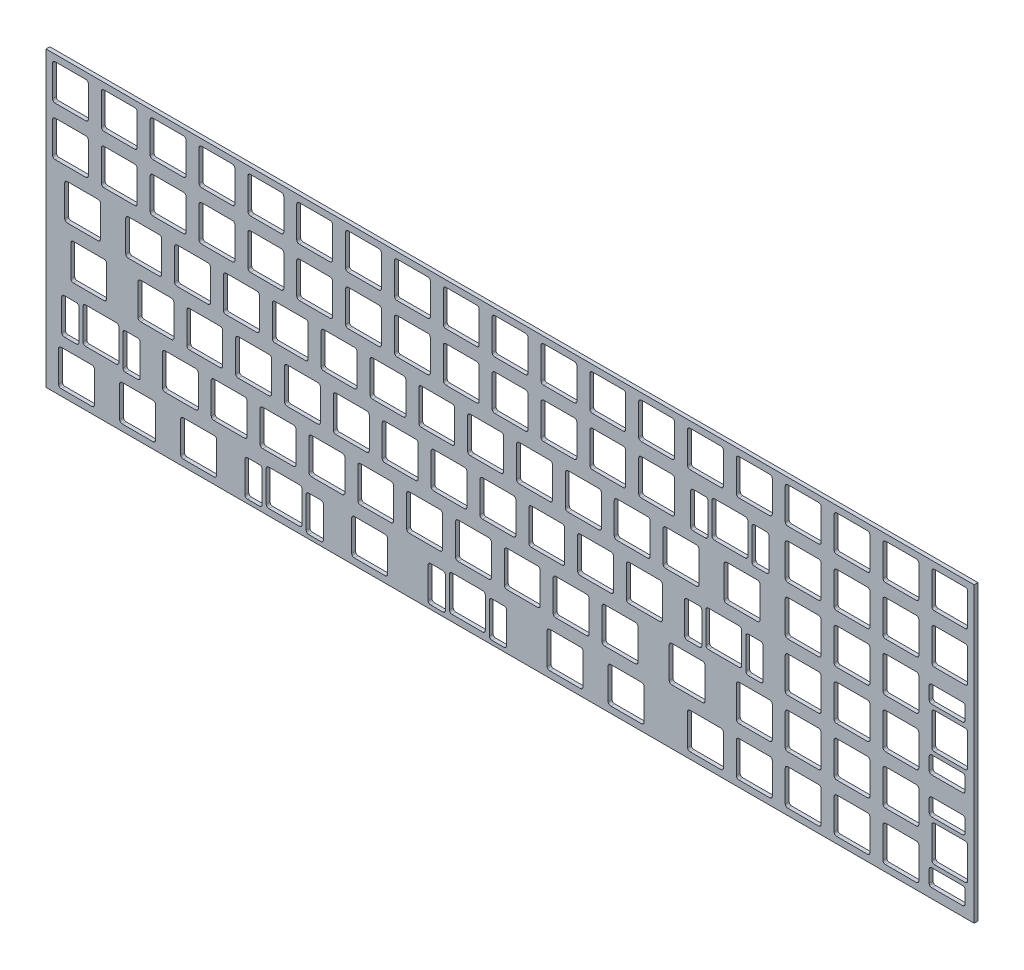
from build123d import *

# Parameters (mm, degrees)
MODEL_W             = 361.952
MODEL_H             = 114.3
BOSS_EXTRUDE1_DEPTH = 1.5


with BuildPart() as part:
    # Model → Boss-Extrude1 (new body)
    with BuildSketch(Plane.XY):
        with Locations((180.976, -57.15)):
            Rectangle(MODEL_W, MODEL_H)
        with BuildLine():
            Line((3.525, -2.525), (15.525, -2.525))
            ThreePointArc((15.525, -2.525), (16.232106781, -2.817893219), (16.525, -3.525))
            Line((16.525, -3.525), (16.525, -15.525))
            ThreePointArc((16.525, -15.525), (16.232106781, -16.232106781), (15.525, -16.525))
            Line((15.525, -16.525), (3.525, -16.525))
            ThreePointArc((3.525, -16.525), (2.817893219, -16.232106781), (2.525, -15.525))
            Line((2.525, -15.525), (2.525, -3.525))
            ThreePointArc((2.525, -3.525), (2.817893219, -2.817893219), (3.525, -2.525))
        make_face(mode=Mode.SUBTRACT)
        with BuildLine():
            Line((22.575, -2.525), (34.575, -2.525))
            ThreePointArc((34.575, -2.525), (35.282106781, -2.817893219), (35.575, -3.525))
            Line((35.575, -3.525), (35.575, -15.525))
            ThreePointArc((35.575, -15.525), (35.282106781, -16.232106781), (34.575, -16.525))
            Line((34.575, -16.525), (22.575, -16.525))
            ThreePointArc((22.575, -16.525), (21.867893219, -16.232106781), (21.575, -15.525))
            Line((21.575, -15.525), (21.575, -3.525))
            ThreePointArc((21.575, -3.525), (21.867893219, -2.817893219), (22.575, -2.525))
        make_face(mode=Mode.SUBTRACT)
        with BuildLine():
            Line((41.625, -2.525), (53.625, -2.525))
            ThreePointArc((53.625, -2.525), (54.332106781, -2.817893219), (54.625, -3.525))
            Line((54.625, -3.525), (54.625, -15.525))
            ThreePointArc((54.625, -15.525), (54.332106781, -16.232106781), (53.625, -16.525))
            Line((53.625, -16.525), (41.625, -16.525))
            ThreePointArc((41.625, -16.525), (40.917893219, -16.232106781), (40.625, -15.525))
            Line((40.625, -15.525), (40.625, -3.525))
            ThreePointArc((40.625, -3.525), (40.917893219, -2.817893219), (41.625, -2.525))
        make_face(mode=Mode.SUBTRACT)
        with BuildLine():
            Line((60.675, -2.525), (72.675, -2.525))
            ThreePointArc((72.675, -2.525), (73.382106781, -2.817893219), (73.675, -3.525))
            Line((73.675, -3.525), (73.675, -15.525))
            ThreePointArc((73.675, -15.525), (73.382106781, -16.232106781), (72.675, -16.525))
            Line((72.675, -16.525), (60.675, -16.525))
            ThreePointArc((60.675, -16.525), (59.967893219, -16.232106781), (59.675, -15.525))
            Line((59.675, -15.525), (59.675, -3.525))
            ThreePointArc((59.675, -3.525), (59.967893219, -2.817893219), (60.675, -2.525))
        make_face(mode=Mode.SUBTRACT)
        with BuildLine():
            Line((79.725, -2.525), (91.725, -2.525))
            ThreePointArc((91.725, -2.525), (92.432106781, -2.817893219), (92.725, -3.525))
            Line((92.725, -3.525), (92.725, -15.525))
            ThreePointArc((92.725, -15.525), (92.432106781, -16.232106781), (91.725, -16.525))
            Line((91.725, -16.525), (79.725, -16.525))
            ThreePointArc((79.725, -16.525), (79.017893219, -16.232106781), (78.725, -15.525))
            Line((78.725, -15.525), (78.725, -3.525))
            ThreePointArc((78.725, -3.525), (79.017893219, -2.817893219), (79.725, -2.525))
        make_face(mode=Mode.SUBTRACT)
        with BuildLine():
            Line((98.775, -2.525), (110.775, -2.525))
            ThreePointArc((110.775, -2.525), (111.482106781, -2.817893219), (111.775, -3.525))
            Line((111.775, -3.525), (111.775, -15.525))
            ThreePointArc((111.775, -15.525), (111.482106781, -16.232106781), (110.775, -16.525))
            Line((110.775, -16.525), (98.775, -16.525))
            ThreePointArc((98.775, -16.525), (98.067893219, -16.232106781), (97.775, -15.525))
            Line((97.775, -15.525), (97.775, -3.525))
            ThreePointArc((97.775, -3.525), (98.067893219, -2.817893219), (98.775, -2.525))
        make_face(mode=Mode.SUBTRACT)
        with BuildLine():
            Line((117.825, -2.525), (129.825, -2.525))
            ThreePointArc((129.825, -2.525), (130.532106781, -2.817893219), (130.825, -3.525))
            Line((130.825, -3.525), (130.825, -15.525))
            ThreePointArc((130.825, -15.525), (130.532106781, -16.232106781), (129.825, -16.525))
            Line((129.825, -16.525), (117.825, -16.525))
            ThreePointArc((117.825, -16.525), (117.117893219, -16.232106781), (116.825, -15.525))
            Line((116.825, -15.525), (116.825, -3.525))
            ThreePointArc((116.825, -3.525), (117.117893219, -2.817893219), (117.825, -2.525))
        make_face(mode=Mode.SUBTRACT)
        with BuildLine():
            Line((136.875, -2.525), (148.875, -2.525))
            ThreePointArc((148.875, -2.525), (149.582106781, -2.817893219), (149.875, -3.525))
            Line((149.875, -3.525), (149.875, -15.525))
            ThreePointArc((149.875, -15.525), (149.582106781, -16.232106781), (148.875, -16.525))
            Line((148.875, -16.525), (136.875, -16.525))
            ThreePointArc((136.875, -16.525), (136.167893219, -16.232106781), (135.875, -15.525))
            Line((135.875, -15.525), (135.875, -3.525))
            ThreePointArc((135.875, -3.525), (136.167893219, -2.817893219), (136.875, -2.525))
        make_face(mode=Mode.SUBTRACT)
        with BuildLine():
            Line((155.925, -2.525), (167.925, -2.525))
            ThreePointArc((167.925, -2.525), (168.632106781, -2.817893219), (168.925, -3.525))
            Line((168.925, -3.525), (168.925, -15.525))
            ThreePointArc((168.925, -15.525), (168.632106781, -16.232106781), (167.925, -16.525))
            Line((167.925, -16.525), (155.925, -16.525))
            ThreePointArc((155.925, -16.525), (155.217893219, -16.232106781), (154.925, -15.525))
            Line((154.925, -15.525), (154.925, -3.525))
            ThreePointArc((154.925, -3.525), (155.217893219, -2.817893219), (155.925, -2.525))
        make_face(mode=Mode.SUBTRACT)
        with BuildLine():
            Line((174.975, -2.525), (186.975, -2.525))
            ThreePointArc((186.975, -2.525), (187.682106781, -2.817893219), (187.975, -3.525))
            Line((187.975, -3.525), (187.975, -15.525))
            ThreePointArc((187.975, -15.525), (187.682106781, -16.232106781), (186.975, -16.525))
            Line((186.975, -16.525), (174.975, -16.525))
            ThreePointArc((174.975, -16.525), (174.267893219, -16.232106781), (173.975, -15.525))
            Line((173.975, -15.525), (173.975, -3.525))
            ThreePointArc((173.975, -3.525), (174.267893219, -2.817893219), (174.975, -2.525))
        make_face(mode=Mode.SUBTRACT)
        with BuildLine():
            Line((194.025, -2.525), (206.025, -2.525))
            ThreePointArc((206.025, -2.525), (206.732106781, -2.817893219), (207.025, -3.525))
            Line((207.025, -3.525), (207.025, -15.525))
            ThreePointArc((207.025, -15.525), (206.732106781, -16.232106781), (206.025, -16.525))
            Line((206.025, -16.525), (194.025, -16.525))
            ThreePointArc((194.025, -16.525), (193.317893219, -16.232106781), (193.025, -15.525))
            Line((193.025, -15.525), (193.025, -3.525))
            ThreePointArc((193.025, -3.525), (193.317893219, -2.817893219), (194.025, -2.525))
        make_face(mode=Mode.SUBTRACT)
        with BuildLine():
            Line((213.075, -2.525), (225.075, -2.525))
            ThreePointArc((225.075, -2.525), (225.782106781, -2.817893219), (226.075, -3.525))
            Line((226.075, -3.525), (226.075, -15.525))
            ThreePointArc((226.075, -15.525), (225.782106781, -16.232106781), (225.075, -16.525))
            Line((225.075, -16.525), (213.075, -16.525))
            ThreePointArc((213.075, -16.525), (212.367893219, -16.232106781), (212.075, -15.525))
            Line((212.075, -15.525), (212.075, -3.525))
            ThreePointArc((212.075, -3.525), (212.367893219, -2.817893219), (213.075, -2.525))
        make_face(mode=Mode.SUBTRACT)
        with BuildLine():
            Line((232.125, -2.525), (244.125, -2.525))
            ThreePointArc((244.125, -2.525), (244.832106781, -2.817893219), (245.125, -3.525))
            Line((245.125, -3.525), (245.125, -15.525))
            ThreePointArc((245.125, -15.525), (244.832106781, -16.232106781), (244.125, -16.525))
            Line((244.125, -16.525), (232.125, -16.525))
            ThreePointArc((232.125, -16.525), (231.417893219, -16.232106781), (231.125, -15.525))
            Line((231.125, -15.525), (231.125, -3.525))
            ThreePointArc((231.125, -3.525), (231.417893219, -2.817893219), (232.125, -2.525))
        make_face(mode=Mode.SUBTRACT)
        with BuildLine():
            Line((251.175, -2.525), (263.175, -2.525))
            ThreePointArc((263.175, -2.525), (263.882106781, -2.817893219), (264.175, -3.525))
            Line((264.175, -3.525), (264.175, -15.525))
            ThreePointArc((264.175, -15.525), (263.882106781, -16.232106781), (263.175, -16.525))
            Line((263.175, -16.525), (251.175, -16.525))
            ThreePointArc((251.175, -16.525), (250.467893219, -16.232106781), (250.175, -15.525))
            Line((250.175, -15.525), (250.175, -3.525))
            ThreePointArc((250.175, -3.525), (250.467893219, -2.817893219), (251.175, -2.525))
        make_face(mode=Mode.SUBTRACT)
        with BuildLine():
            Line((270.225, -2.525), (282.225, -2.525))
            ThreePointArc((282.225, -2.525), (282.932106781, -2.817893219), (283.225, -3.525))
            Line((283.225, -3.525), (283.225, -15.525))
            ThreePointArc((283.225, -15.525), (282.932106781, -16.232106781), (282.225, -16.525))
            Line((282.225, -16.525), (270.225, -16.525))
            ThreePointArc((270.225, -16.525), (269.517893219, -16.232106781), (269.225, -15.525))
            Line((269.225, -15.525), (269.225, -3.525))
            ThreePointArc((269.225, -3.525), (269.517893219, -2.817893219), (270.225, -2.525))
        make_face(mode=Mode.SUBTRACT)
        with BuildLine():
            Line((289.275, -2.525), (301.275, -2.525))
            ThreePointArc((301.275, -2.525), (301.982106781, -2.817893219), (302.275, -3.525))
            Line((302.275, -3.525), (302.275, -15.525))
            ThreePointArc((302.275, -15.525), (301.982106781, -16.232106781), (301.275, -16.525))
            Line((301.275, -16.525), (289.275, -16.525))
            ThreePointArc((289.275, -16.525), (288.567893219, -16.232106781), (288.275, -15.525))
            Line((288.275, -15.525), (288.275, -3.525))
            ThreePointArc((288.275, -3.525), (288.567893219, -2.817893219), (289.275, -2.525))
        make_face(mode=Mode.SUBTRACT)
        with BuildLine():
            Line((308.325, -2.525), (320.325, -2.525))
            ThreePointArc((320.325, -2.525), (321.032106781, -2.817893219), (321.325, -3.525))
            Line((321.325, -3.525), (321.325, -15.525))
            ThreePointArc((321.325, -15.525), (321.032106781, -16.232106781), (320.325, -16.525))
            Line((320.325, -16.525), (308.325, -16.525))
            ThreePointArc((308.325, -16.525), (307.617893219, -16.232106781), (307.325, -15.525))
            Line((307.325, -15.525), (307.325, -3.525))
            ThreePointArc((307.325, -3.525), (307.617893219, -2.817893219), (308.325, -2.525))
        make_face(mode=Mode.SUBTRACT)
        with BuildLine():
            Line((327.375, -2.525), (339.375, -2.525))
            ThreePointArc((339.375, -2.525), (340.082106781, -2.817893219), (340.375, -3.525))
            Line((340.375, -3.525), (340.375, -15.525))
            ThreePointArc((340.375, -15.525), (340.082106781, -16.232106781), (339.375, -16.525))
            Line((339.375, -16.525), (327.375, -16.525))
            ThreePointArc((327.375, -16.525), (326.667893219, -16.232106781), (326.375, -15.525))
            Line((326.375, -15.525), (326.375, -3.525))
            ThreePointArc((326.375, -3.525), (326.667893219, -2.817893219), (327.375, -2.525))
        make_face(mode=Mode.SUBTRACT)
        with BuildLine():
            Line((346.425, -2.525), (358.425, -2.525))
            ThreePointArc((358.425, -2.525), (359.132106781, -2.817893219), (359.425, -3.525))
            Line((359.425, -3.525), (359.425, -15.525))
            ThreePointArc((359.425, -15.525), (359.132106781, -16.232106781), (358.425, -16.525))
            Line((358.425, -16.525), (346.425, -16.525))
            ThreePointArc((346.425, -16.525), (345.717893219, -16.232106781), (345.425, -15.525))
            Line((345.425, -15.525), (345.425, -3.525))
            ThreePointArc((345.425, -3.525), (345.717893219, -2.817893219), (346.425, -2.525))
        make_face(mode=Mode.SUBTRACT)
        with BuildLine():
            Line((3.525, -21.575), (15.525, -21.575))
            ThreePointArc((15.525, -21.575), (16.232106781, -21.867893219), (16.525, -22.575))
            Line((16.525, -22.575), (16.525, -34.575))
            ThreePointArc((16.525, -34.575), (16.232106781, -35.282106781), (15.525, -35.575))
            Line((15.525, -35.575), (3.525, -35.575))
            ThreePointArc((3.525, -35.575), (2.817893219, -35.282106781), (2.525, -34.575))
            Line((2.525, -34.575), (2.525, -22.575))
            ThreePointArc((2.525, -22.575), (2.817893219, -21.867893219), (3.525, -21.575))
        make_face(mode=Mode.SUBTRACT)
        with BuildLine():
            Line((22.575, -21.575), (34.575, -21.575))
            ThreePointArc((34.575, -21.575), (35.282106781, -21.867893219), (35.575, -22.575))
            Line((35.575, -22.575), (35.575, -34.575))
            ThreePointArc((35.575, -34.575), (35.282106781, -35.282106781), (34.575, -35.575))
            Line((34.575, -35.575), (22.575, -35.575))
            ThreePointArc((22.575, -35.575), (21.867893219, -35.282106781), (21.575, -34.575))
            Line((21.575, -34.575), (21.575, -22.575))
            ThreePointArc((21.575, -22.575), (21.867893219, -21.867893219), (22.575, -21.575))
        make_face(mode=Mode.SUBTRACT)
        with BuildLine():
            Line((41.625, -21.575), (53.625, -21.575))
            ThreePointArc((53.625, -21.575), (54.332106781, -21.867893219), (54.625, -22.575))
            Line((54.625, -22.575), (54.625, -34.575))
            ThreePointArc((54.625, -34.575), (54.332106781, -35.282106781), (53.625, -35.575))
            Line((53.625, -35.575), (41.625, -35.575))
            ThreePointArc((41.625, -35.575), (40.917893219, -35.282106781), (40.625, -34.575))
            Line((40.625, -34.575), (40.625, -22.575))
            ThreePointArc((40.625, -22.575), (40.917893219, -21.867893219), (41.625, -21.575))
        make_face(mode=Mode.SUBTRACT)
        with BuildLine():
            Line((60.675, -21.575), (72.675, -21.575))
            ThreePointArc((72.675, -21.575), (73.382106781, -21.867893219), (73.675, -22.575))
            Line((73.675, -22.575), (73.675, -34.575))
            ThreePointArc((73.675, -34.575), (73.382106781, -35.282106781), (72.675, -35.575))
            Line((72.675, -35.575), (60.675, -35.575))
            ThreePointArc((60.675, -35.575), (59.967893219, -35.282106781), (59.675, -34.575))
            Line((59.675, -34.575), (59.675, -22.575))
            ThreePointArc((59.675, -22.575), (59.967893219, -21.867893219), (60.675, -21.575))
        make_face(mode=Mode.SUBTRACT)
        with BuildLine():
            Line((79.725, -21.575), (91.725, -21.575))
            ThreePointArc((91.725, -21.575), (92.432106781, -21.867893219), (92.725, -22.575))
            Line((92.725, -22.575), (92.725, -34.575))
            ThreePointArc((92.725, -34.575), (92.432106781, -35.282106781), (91.725, -35.575))
            Line((91.725, -35.575), (79.725, -35.575))
            ThreePointArc((79.725, -35.575), (79.017893219, -35.282106781), (78.725, -34.575))
            Line((78.725, -34.575), (78.725, -22.575))
            ThreePointArc((78.725, -22.575), (79.017893219, -21.867893219), (79.725, -21.575))
        make_face(mode=Mode.SUBTRACT)
        with BuildLine():
            Line((98.775, -21.575), (110.775, -21.575))
            ThreePointArc((110.775, -21.575), (111.482106781, -21.867893219), (111.775, -22.575))
            Line((111.775, -22.575), (111.775, -34.575))
            ThreePointArc((111.775, -34.575), (111.482106781, -35.282106781), (110.775, -35.575))
            Line((110.775, -35.575), (98.775, -35.575))
            ThreePointArc((98.775, -35.575), (98.067893219, -35.282106781), (97.775, -34.575))
            Line((97.775, -34.575), (97.775, -22.575))
            ThreePointArc((97.775, -22.575), (98.067893219, -21.867893219), (98.775, -21.575))
        make_face(mode=Mode.SUBTRACT)
        with BuildLine():
            Line((117.825, -21.575), (129.825, -21.575))
            ThreePointArc((129.825, -21.575), (130.532106781, -21.867893219), (130.825, -22.575))
            Line((130.825, -22.575), (130.825, -34.575))
            ThreePointArc((130.825, -34.575), (130.532106781, -35.282106781), (129.825, -35.575))
            Line((129.825, -35.575), (117.825, -35.575))
            ThreePointArc((117.825, -35.575), (117.117893219, -35.282106781), (116.825, -34.575))
            Line((116.825, -34.575), (116.825, -22.575))
            ThreePointArc((116.825, -22.575), (117.117893219, -21.867893219), (117.825, -21.575))
        make_face(mode=Mode.SUBTRACT)
        with BuildLine():
            Line((136.875, -21.575), (148.875, -21.575))
            ThreePointArc((148.875, -21.575), (149.582106781, -21.867893219), (149.875, -22.575))
            Line((149.875, -22.575), (149.875, -34.575))
            ThreePointArc((149.875, -34.575), (149.582106781, -35.282106781), (148.875, -35.575))
            Line((148.875, -35.575), (136.875, -35.575))
            ThreePointArc((136.875, -35.575), (136.167893219, -35.282106781), (135.875, -34.575))
            Line((135.875, -34.575), (135.875, -22.575))
            ThreePointArc((135.875, -22.575), (136.167893219, -21.867893219), (136.875, -21.575))
        make_face(mode=Mode.SUBTRACT)
        with BuildLine():
            Line((155.925, -21.575), (167.925, -21.575))
            ThreePointArc((167.925, -21.575), (168.632106781, -21.867893219), (168.925, -22.575))
            Line((168.925, -22.575), (168.925, -34.575))
            ThreePointArc((168.925, -34.575), (168.632106781, -35.282106781), (167.925, -35.575))
            Line((167.925, -35.575), (155.925, -35.575))
            ThreePointArc((155.925, -35.575), (155.217893219, -35.282106781), (154.925, -34.575))
            Line((154.925, -34.575), (154.925, -22.575))
            ThreePointArc((154.925, -22.575), (155.217893219, -21.867893219), (155.925, -21.575))
        make_face(mode=Mode.SUBTRACT)
        with BuildLine():
            Line((174.975, -21.575), (186.975, -21.575))
            ThreePointArc((186.975, -21.575), (187.682106781, -21.867893219), (187.975, -22.575))
            Line((187.975, -22.575), (187.975, -34.575))
            ThreePointArc((187.975, -34.575), (187.682106781, -35.282106781), (186.975, -35.575))
            Line((186.975, -35.575), (174.975, -35.575))
            ThreePointArc((174.975, -35.575), (174.267893219, -35.282106781), (173.975, -34.575))
            Line((173.975, -34.575), (173.975, -22.575))
            ThreePointArc((173.975, -22.575), (174.267893219, -21.867893219), (174.975, -21.575))
        make_face(mode=Mode.SUBTRACT)
        with BuildLine():
            Line((194.025, -21.575), (206.025, -21.575))
            ThreePointArc((206.025, -21.575), (206.732106781, -21.867893219), (207.025, -22.575))
            Line((207.025, -22.575), (207.025, -34.575))
            ThreePointArc((207.025, -34.575), (206.732106781, -35.282106781), (206.025, -35.575))
            Line((206.025, -35.575), (194.025, -35.575))
            ThreePointArc((194.025, -35.575), (193.317893219, -35.282106781), (193.025, -34.575))
            Line((193.025, -34.575), (193.025, -22.575))
            ThreePointArc((193.025, -22.575), (193.317893219, -21.867893219), (194.025, -21.575))
        make_face(mode=Mode.SUBTRACT)
        with BuildLine():
            Line((213.075, -21.575), (225.075, -21.575))
            ThreePointArc((225.075, -21.575), (225.782106781, -21.867893219), (226.075, -22.575))
            Line((226.075, -22.575), (226.075, -34.575))
            ThreePointArc((226.075, -34.575), (225.782106781, -35.282106781), (225.075, -35.575))
            Line((225.075, -35.575), (213.075, -35.575))
            ThreePointArc((213.075, -35.575), (212.367893219, -35.282106781), (212.075, -34.575))
            Line((212.075, -34.575), (212.075, -22.575))
            ThreePointArc((212.075, -22.575), (212.367893219, -21.867893219), (213.075, -21.575))
        make_face(mode=Mode.SUBTRACT)
        with BuildLine():
            Line((232.125, -21.575), (244.125, -21.575))
            ThreePointArc((244.125, -21.575), (244.832106781, -21.867893219), (245.125, -22.575))
            Line((245.125, -22.575), (245.125, -34.575))
            ThreePointArc((245.125, -34.575), (244.832106781, -35.282106781), (244.125, -35.575))
            Line((244.125, -35.575), (232.125, -35.575))
            ThreePointArc((232.125, -35.575), (231.417893219, -35.282106781), (231.125, -34.575))
            Line((231.125, -34.575), (231.125, -22.575))
            ThreePointArc((231.125, -22.575), (231.417893219, -21.867893219), (232.125, -21.575))
        make_face(mode=Mode.SUBTRACT)
        with BuildLine():
            Line((260.7, -21.575), (272.7, -21.575))
            ThreePointArc((272.7, -21.575), (273.407106781, -21.867893219), (273.7, -22.575))
            Line((273.7, -22.575), (273.7, -34.575))
            ThreePointArc((273.7, -34.575), (273.407106781, -35.282106781), (272.7, -35.575))
            Line((272.7, -35.575), (260.7, -35.575))
            ThreePointArc((260.7, -35.575), (259.992893219, -35.282106781), (259.7, -34.575))
            Line((259.7, -34.575), (259.7, -22.575))
            ThreePointArc((259.7, -22.575), (259.992893219, -21.867893219), (260.7, -21.575))
        make_face(mode=Mode.SUBTRACT)
        with BuildLine():
            Line((276.263, -22.575), (281.013, -22.575))
            ThreePointArc((281.013, -22.575), (281.720106781, -22.867893219), (282.013, -23.575))
            Line((282.013, -23.575), (282.013, -35.575))
            ThreePointArc((282.013, -35.575), (281.720106781, -36.282106781), (281.013, -36.575))
            Line((281.013, -36.575), (276.263, -36.575))
            ThreePointArc((276.263, -36.575), (275.555893219, -36.282106781), (275.263, -35.575))
            Line((275.263, -35.575), (275.263, -23.575))
            ThreePointArc((275.263, -23.575), (275.555893219, -22.867893219), (276.263, -22.575))
        make_face(mode=Mode.SUBTRACT)
        with BuildLine():
            Line((252.387, -22.575), (257.137, -22.575))
            ThreePointArc((257.137, -22.575), (257.844106781, -22.867893219), (258.137, -23.575))
            Line((258.137, -23.575), (258.137, -35.575))
            ThreePointArc((258.137, -35.575), (257.844106781, -36.282106781), (257.137, -36.575))
            Line((257.137, -36.575), (252.387, -36.575))
            ThreePointArc((252.387, -36.575), (251.679893219, -36.282106781), (251.387, -35.575))
            Line((251.387, -35.575), (251.387, -23.575))
            ThreePointArc((251.387, -23.575), (251.679893219, -22.867893219), (252.387, -22.575))
        make_face(mode=Mode.SUBTRACT)
        with BuildLine():
            Line((289.275, -21.575), (301.275, -21.575))
            ThreePointArc((301.275, -21.575), (301.982106781, -21.867893219), (302.275, -22.575))
            Line((302.275, -22.575), (302.275, -34.575))
            ThreePointArc((302.275, -34.575), (301.982106781, -35.282106781), (301.275, -35.575))
            Line((301.275, -35.575), (289.275, -35.575))
            ThreePointArc((289.275, -35.575), (288.567893219, -35.282106781), (288.275, -34.575))
            Line((288.275, -34.575), (288.275, -22.575))
            ThreePointArc((288.275, -22.575), (288.567893219, -21.867893219), (289.275, -21.575))
        make_face(mode=Mode.SUBTRACT)
        with BuildLine():
            Line((308.325, -21.575), (320.325, -21.575))
            ThreePointArc((320.325, -21.575), (321.032106781, -21.867893219), (321.325, -22.575))
            Line((321.325, -22.575), (321.325, -34.575))
            ThreePointArc((321.325, -34.575), (321.032106781, -35.282106781), (320.325, -35.575))
            Line((320.325, -35.575), (308.325, -35.575))
            ThreePointArc((308.325, -35.575), (307.617893219, -35.282106781), (307.325, -34.575))
            Line((307.325, -34.575), (307.325, -22.575))
            ThreePointArc((307.325, -22.575), (307.617893219, -21.867893219), (308.325, -21.575))
        make_face(mode=Mode.SUBTRACT)
        with BuildLine():
            Line((327.375, -21.575), (339.375, -21.575))
            ThreePointArc((339.375, -21.575), (340.082106781, -21.867893219), (340.375, -22.575))
            Line((340.375, -22.575), (340.375, -34.575))
            ThreePointArc((340.375, -34.575), (340.082106781, -35.282106781), (339.375, -35.575))
            Line((339.375, -35.575), (327.375, -35.575))
            ThreePointArc((327.375, -35.575), (326.667893219, -35.282106781), (326.375, -34.575))
            Line((326.375, -34.575), (326.375, -22.575))
            ThreePointArc((326.375, -22.575), (326.667893219, -21.867893219), (327.375, -21.575))
        make_face(mode=Mode.SUBTRACT)
        with BuildLine():
            Line((346.425, -21.575), (358.425, -21.575))
            ThreePointArc((358.425, -21.575), (359.132106781, -21.867893219), (359.425, -22.575))
            Line((359.425, -22.575), (359.425, -34.575))
            ThreePointArc((359.425, -34.575), (359.132106781, -35.282106781), (358.425, -35.575))
            Line((358.425, -35.575), (346.425, -35.575))
            ThreePointArc((346.425, -35.575), (345.717893219, -35.282106781), (345.425, -34.575))
            Line((345.425, -34.575), (345.425, -22.575))
            ThreePointArc((345.425, -22.575), (345.717893219, -21.867893219), (346.425, -21.575))
        make_face(mode=Mode.SUBTRACT)
        with BuildLine():
            Line((8.2875, -40.625), (20.2875, -40.625))
            ThreePointArc((20.2875, -40.625), (20.994606781, -40.917893219), (21.2875, -41.625))
            Line((21.2875, -41.625), (21.2875, -53.625))
            ThreePointArc((21.2875, -53.625), (20.994606781, -54.332106781), (20.2875, -54.625))
            Line((20.2875, -54.625), (8.2875, -54.625))
            ThreePointArc((8.2875, -54.625), (7.580393219, -54.332106781), (7.2875, -53.625))
            Line((7.2875, -53.625), (7.2875, -41.625))
            ThreePointArc((7.2875, -41.625), (7.580393219, -40.917893219), (8.2875, -40.625))
        make_face(mode=Mode.SUBTRACT)
        with BuildLine():
            Line((32.1, -40.625), (44.1, -40.625))
            ThreePointArc((44.1, -40.625), (44.807106781, -40.917893219), (45.1, -41.625))
            Line((45.1, -41.625), (45.1, -53.625))
            ThreePointArc((45.1, -53.625), (44.807106781, -54.332106781), (44.1, -54.625))
            Line((44.1, -54.625), (32.1, -54.625))
            ThreePointArc((32.1, -54.625), (31.392893219, -54.332106781), (31.1, -53.625))
            Line((31.1, -53.625), (31.1, -41.625))
            ThreePointArc((31.1, -41.625), (31.392893219, -40.917893219), (32.1, -40.625))
        make_face(mode=Mode.SUBTRACT)
        with BuildLine():
            Line((51.15, -40.625), (63.15, -40.625))
            ThreePointArc((63.15, -40.625), (63.857106781, -40.917893219), (64.15, -41.625))
            Line((64.15, -41.625), (64.15, -53.625))
            ThreePointArc((64.15, -53.625), (63.857106781, -54.332106781), (63.15, -54.625))
            Line((63.15, -54.625), (51.15, -54.625))
            ThreePointArc((51.15, -54.625), (50.442893219, -54.332106781), (50.15, -53.625))
            Line((50.15, -53.625), (50.15, -41.625))
            ThreePointArc((50.15, -41.625), (50.442893219, -40.917893219), (51.15, -40.625))
        make_face(mode=Mode.SUBTRACT)
        with BuildLine():
            Line((70.2, -40.625), (82.2, -40.625))
            ThreePointArc((82.2, -40.625), (82.907106781, -40.917893219), (83.2, -41.625))
            Line((83.2, -41.625), (83.2, -53.625))
            ThreePointArc((83.2, -53.625), (82.907106781, -54.332106781), (82.2, -54.625))
            Line((82.2, -54.625), (70.2, -54.625))
            ThreePointArc((70.2, -54.625), (69.492893219, -54.332106781), (69.2, -53.625))
            Line((69.2, -53.625), (69.2, -41.625))
            ThreePointArc((69.2, -41.625), (69.492893219, -40.917893219), (70.2, -40.625))
        make_face(mode=Mode.SUBTRACT)
        with BuildLine():
            Line((89.25, -40.625), (101.25, -40.625))
            ThreePointArc((101.25, -40.625), (101.957106781, -40.917893219), (102.25, -41.625))
            Line((102.25, -41.625), (102.25, -53.625))
            ThreePointArc((102.25, -53.625), (101.957106781, -54.332106781), (101.25, -54.625))
            Line((101.25, -54.625), (89.25, -54.625))
            ThreePointArc((89.25, -54.625), (88.542893219, -54.332106781), (88.25, -53.625))
            Line((88.25, -53.625), (88.25, -41.625))
            ThreePointArc((88.25, -41.625), (88.542893219, -40.917893219), (89.25, -40.625))
        make_face(mode=Mode.SUBTRACT)
        with BuildLine():
            Line((108.3, -40.625), (120.3, -40.625))
            ThreePointArc((120.3, -40.625), (121.007106781, -40.917893219), (121.3, -41.625))
            Line((121.3, -41.625), (121.3, -53.625))
            ThreePointArc((121.3, -53.625), (121.007106781, -54.332106781), (120.3, -54.625))
            Line((120.3, -54.625), (108.3, -54.625))
            ThreePointArc((108.3, -54.625), (107.592893219, -54.332106781), (107.3, -53.625))
            Line((107.3, -53.625), (107.3, -41.625))
            ThreePointArc((107.3, -41.625), (107.592893219, -40.917893219), (108.3, -40.625))
        make_face(mode=Mode.SUBTRACT)
        with BuildLine():
            Line((127.35, -40.625), (139.35, -40.625))
            ThreePointArc((139.35, -40.625), (140.057106781, -40.917893219), (140.35, -41.625))
            Line((140.35, -41.625), (140.35, -53.625))
            ThreePointArc((140.35, -53.625), (140.057106781, -54.332106781), (139.35, -54.625))
            Line((139.35, -54.625), (127.35, -54.625))
            ThreePointArc((127.35, -54.625), (126.642893219, -54.332106781), (126.35, -53.625))
            Line((126.35, -53.625), (126.35, -41.625))
            ThreePointArc((126.35, -41.625), (126.642893219, -40.917893219), (127.35, -40.625))
        make_face(mode=Mode.SUBTRACT)
        with BuildLine():
            Line((146.4, -40.625), (158.4, -40.625))
            ThreePointArc((158.4, -40.625), (159.107106781, -40.917893219), (159.4, -41.625))
            Line((159.4, -41.625), (159.4, -53.625))
            ThreePointArc((159.4, -53.625), (159.107106781, -54.332106781), (158.4, -54.625))
            Line((158.4, -54.625), (146.4, -54.625))
            ThreePointArc((146.4, -54.625), (145.692893219, -54.332106781), (145.4, -53.625))
            Line((145.4, -53.625), (145.4, -41.625))
            ThreePointArc((145.4, -41.625), (145.692893219, -40.917893219), (146.4, -40.625))
        make_face(mode=Mode.SUBTRACT)
        with BuildLine():
            Line((165.45, -40.625), (177.45, -40.625))
            ThreePointArc((177.45, -40.625), (178.157106781, -40.917893219), (178.45, -41.625))
            Line((178.45, -41.625), (178.45, -53.625))
            ThreePointArc((178.45, -53.625), (178.157106781, -54.332106781), (177.45, -54.625))
            Line((177.45, -54.625), (165.45, -54.625))
            ThreePointArc((165.45, -54.625), (164.742893219, -54.332106781), (164.45, -53.625))
            Line((164.45, -53.625), (164.45, -41.625))
            ThreePointArc((164.45, -41.625), (164.742893219, -40.917893219), (165.45, -40.625))
        make_face(mode=Mode.SUBTRACT)
        with BuildLine():
            Line((184.5, -40.625), (196.5, -40.625))
            ThreePointArc((196.5, -40.625), (197.207106781, -40.917893219), (197.5, -41.625))
            Line((197.5, -41.625), (197.5, -53.625))
            ThreePointArc((197.5, -53.625), (197.207106781, -54.332106781), (196.5, -54.625))
            Line((196.5, -54.625), (184.5, -54.625))
            ThreePointArc((184.5, -54.625), (183.792893219, -54.332106781), (183.5, -53.625))
            Line((183.5, -53.625), (183.5, -41.625))
            ThreePointArc((183.5, -41.625), (183.792893219, -40.917893219), (184.5, -40.625))
        make_face(mode=Mode.SUBTRACT)
        with BuildLine():
            Line((203.55, -40.625), (215.55, -40.625))
            ThreePointArc((215.55, -40.625), (216.257106781, -40.917893219), (216.55, -41.625))
            Line((216.55, -41.625), (216.55, -53.625))
            ThreePointArc((216.55, -53.625), (216.257106781, -54.332106781), (215.55, -54.625))
            Line((215.55, -54.625), (203.55, -54.625))
            ThreePointArc((203.55, -54.625), (202.842893219, -54.332106781), (202.55, -53.625))
            Line((202.55, -53.625), (202.55, -41.625))
            ThreePointArc((202.55, -41.625), (202.842893219, -40.917893219), (203.55, -40.625))
        make_face(mode=Mode.SUBTRACT)
        with BuildLine():
            Line((222.6, -40.625), (234.6, -40.625))
            ThreePointArc((234.6, -40.625), (235.307106781, -40.917893219), (235.6, -41.625))
            Line((235.6, -41.625), (235.6, -53.625))
            ThreePointArc((235.6, -53.625), (235.307106781, -54.332106781), (234.6, -54.625))
            Line((234.6, -54.625), (222.6, -54.625))
            ThreePointArc((222.6, -54.625), (221.892893219, -54.332106781), (221.6, -53.625))
            Line((221.6, -53.625), (221.6, -41.625))
            ThreePointArc((221.6, -41.625), (221.892893219, -40.917893219), (222.6, -40.625))
        make_face(mode=Mode.SUBTRACT)
        with BuildLine():
            Line((241.65, -40.625), (253.65, -40.625))
            ThreePointArc((253.65, -40.625), (254.357106781, -40.917893219), (254.65, -41.625))
            Line((254.65, -41.625), (254.65, -53.625))
            ThreePointArc((254.65, -53.625), (254.357106781, -54.332106781), (253.65, -54.625))
            Line((253.65, -54.625), (241.65, -54.625))
            ThreePointArc((241.65, -54.625), (240.942893219, -54.332106781), (240.65, -53.625))
            Line((240.65, -53.625), (240.65, -41.625))
            ThreePointArc((240.65, -41.625), (240.942893219, -40.917893219), (241.65, -40.625))
        make_face(mode=Mode.SUBTRACT)
        with BuildLine():
            Line((265.4625, -40.625), (277.4625, -40.625))
            ThreePointArc((277.4625, -40.625), (278.169606781, -40.917893219), (278.4625, -41.625))
            Line((278.4625, -41.625), (278.4625, -53.625))
            ThreePointArc((278.4625, -53.625), (278.169606781, -54.332106781), (277.4625, -54.625))
            Line((277.4625, -54.625), (265.4625, -54.625))
            ThreePointArc((265.4625, -54.625), (264.755393219, -54.332106781), (264.4625, -53.625))
            Line((264.4625, -53.625), (264.4625, -41.625))
            ThreePointArc((264.4625, -41.625), (264.755393219, -40.917893219), (265.4625, -40.625))
        make_face(mode=Mode.SUBTRACT)
        with BuildLine():
            Line((289.275, -40.625), (301.275, -40.625))
            ThreePointArc((301.275, -40.625), (301.982106781, -40.917893219), (302.275, -41.625))
            Line((302.275, -41.625), (302.275, -53.625))
            ThreePointArc((302.275, -53.625), (301.982106781, -54.332106781), (301.275, -54.625))
            Line((301.275, -54.625), (289.275, -54.625))
            ThreePointArc((289.275, -54.625), (288.567893219, -54.332106781), (288.275, -53.625))
            Line((288.275, -53.625), (288.275, -41.625))
            ThreePointArc((288.275, -41.625), (288.567893219, -40.917893219), (289.275, -40.625))
        make_face(mode=Mode.SUBTRACT)
        with BuildLine():
            Line((308.325, -40.625), (320.325, -40.625))
            ThreePointArc((320.325, -40.625), (321.032106781, -40.917893219), (321.325, -41.625))
            Line((321.325, -41.625), (321.325, -53.625))
            ThreePointArc((321.325, -53.625), (321.032106781, -54.332106781), (320.325, -54.625))
            Line((320.325, -54.625), (308.325, -54.625))
            ThreePointArc((308.325, -54.625), (307.617893219, -54.332106781), (307.325, -53.625))
            Line((307.325, -53.625), (307.325, -41.625))
            ThreePointArc((307.325, -41.625), (307.617893219, -40.917893219), (308.325, -40.625))
        make_face(mode=Mode.SUBTRACT)
        with BuildLine():
            Line((327.375, -40.625), (339.375, -40.625))
            ThreePointArc((339.375, -40.625), (340.082106781, -40.917893219), (340.375, -41.625))
            Line((340.375, -41.625), (340.375, -53.625))
            ThreePointArc((340.375, -53.625), (340.082106781, -54.332106781), (339.375, -54.625))
            Line((339.375, -54.625), (327.375, -54.625))
            ThreePointArc((327.375, -54.625), (326.667893219, -54.332106781), (326.375, -53.625))
            Line((326.375, -53.625), (326.375, -41.625))
            ThreePointArc((326.375, -41.625), (326.667893219, -40.917893219), (327.375, -40.625))
        make_face(mode=Mode.SUBTRACT)
        with BuildLine():
            Line((359.425, -51.15), (359.425, -63.15))
            ThreePointArc((359.425, -63.15), (359.132106781, -63.857106781), (358.425, -64.15))
            Line((358.425, -64.15), (346.425, -64.15))
            ThreePointArc((346.425, -64.15), (345.717893219, -63.857106781), (345.425, -63.15))
            Line((345.425, -63.15), (345.425, -51.15))
            ThreePointArc((345.425, -51.15), (345.717893219, -50.442893219), (346.425, -50.15))
            Line((346.425, -50.15), (358.425, -50.15))
            ThreePointArc((358.425, -50.15), (359.132106781, -50.442893219), (359.425, -51.15))
        make_face(mode=Mode.SUBTRACT)
        with BuildLine():
            Line((358.425, -66.713), (358.425, -71.463))
            ThreePointArc((358.425, -71.463), (358.132106781, -72.170106781), (357.425, -72.463))
            Line((357.425, -72.463), (345.425, -72.463))
            ThreePointArc((345.425, -72.463), (344.717893219, -72.170106781), (344.425, -71.463))
            Line((344.425, -71.463), (344.425, -66.713))
            ThreePointArc((344.425, -66.713), (344.717893219, -66.005893219), (345.425, -65.713))
            Line((345.425, -65.713), (357.425, -65.713))
            ThreePointArc((357.425, -65.713), (358.132106781, -66.005893219), (358.425, -66.713))
        make_face(mode=Mode.SUBTRACT)
        with BuildLine():
            Line((358.425, -42.837), (358.425, -47.587))
            ThreePointArc((358.425, -47.587), (358.132106781, -48.294106781), (357.425, -48.587))
            Line((357.425, -48.587), (345.425, -48.587))
            ThreePointArc((345.425, -48.587), (344.717893219, -48.294106781), (344.425, -47.587))
            Line((344.425, -47.587), (344.425, -42.837))
            ThreePointArc((344.425, -42.837), (344.717893219, -42.129893219), (345.425, -41.837))
            Line((345.425, -41.837), (357.425, -41.837))
            ThreePointArc((357.425, -41.837), (358.132106781, -42.129893219), (358.425, -42.837))
        make_face(mode=Mode.SUBTRACT)
        with BuildLine():
            Line((10.66875, -59.675), (22.66875, -59.675))
            ThreePointArc((22.66875, -59.675), (23.375856781, -59.967893219), (23.66875, -60.675))
            Line((23.66875, -60.675), (23.66875, -72.675))
            ThreePointArc((23.66875, -72.675), (23.375856781, -73.382106781), (22.66875, -73.675))
            Line((22.66875, -73.675), (10.66875, -73.675))
            ThreePointArc((10.66875, -73.675), (9.961643219, -73.382106781), (9.66875, -72.675))
            Line((9.66875, -72.675), (9.66875, -60.675))
            ThreePointArc((9.66875, -60.675), (9.961643219, -59.967893219), (10.66875, -59.675))
        make_face(mode=Mode.SUBTRACT)
        with BuildLine():
            Line((36.8625, -59.675), (48.8625, -59.675))
            ThreePointArc((48.8625, -59.675), (49.569606781, -59.967893219), (49.8625, -60.675))
            Line((49.8625, -60.675), (49.8625, -72.675))
            ThreePointArc((49.8625, -72.675), (49.569606781, -73.382106781), (48.8625, -73.675))
            Line((48.8625, -73.675), (36.8625, -73.675))
            ThreePointArc((36.8625, -73.675), (36.155393219, -73.382106781), (35.8625, -72.675))
            Line((35.8625, -72.675), (35.8625, -60.675))
            ThreePointArc((35.8625, -60.675), (36.155393219, -59.967893219), (36.8625, -59.675))
        make_face(mode=Mode.SUBTRACT)
        with BuildLine():
            Line((55.9125, -59.675), (67.9125, -59.675))
            ThreePointArc((67.9125, -59.675), (68.619606781, -59.967893219), (68.9125, -60.675))
            Line((68.9125, -60.675), (68.9125, -72.675))
            ThreePointArc((68.9125, -72.675), (68.619606781, -73.382106781), (67.9125, -73.675))
            Line((67.9125, -73.675), (55.9125, -73.675))
            ThreePointArc((55.9125, -73.675), (55.205393219, -73.382106781), (54.9125, -72.675))
            Line((54.9125, -72.675), (54.9125, -60.675))
            ThreePointArc((54.9125, -60.675), (55.205393219, -59.967893219), (55.9125, -59.675))
        make_face(mode=Mode.SUBTRACT)
        with BuildLine():
            Line((74.9625, -59.675), (86.9625, -59.675))
            ThreePointArc((86.9625, -59.675), (87.669606781, -59.967893219), (87.9625, -60.675))
            Line((87.9625, -60.675), (87.9625, -72.675))
            ThreePointArc((87.9625, -72.675), (87.669606781, -73.382106781), (86.9625, -73.675))
            Line((86.9625, -73.675), (74.9625, -73.675))
            ThreePointArc((74.9625, -73.675), (74.255393219, -73.382106781), (73.9625, -72.675))
            Line((73.9625, -72.675), (73.9625, -60.675))
            ThreePointArc((73.9625, -60.675), (74.255393219, -59.967893219), (74.9625, -59.675))
        make_face(mode=Mode.SUBTRACT)
        with BuildLine():
            Line((94.0125, -59.675), (106.0125, -59.675))
            ThreePointArc((106.0125, -59.675), (106.719606781, -59.967893219), (107.0125, -60.675))
            Line((107.0125, -60.675), (107.0125, -72.675))
            ThreePointArc((107.0125, -72.675), (106.719606781, -73.382106781), (106.0125, -73.675))
            Line((106.0125, -73.675), (94.0125, -73.675))
            ThreePointArc((94.0125, -73.675), (93.305393219, -73.382106781), (93.0125, -72.675))
            Line((93.0125, -72.675), (93.0125, -60.675))
            ThreePointArc((93.0125, -60.675), (93.305393219, -59.967893219), (94.0125, -59.675))
        make_face(mode=Mode.SUBTRACT)
        with BuildLine():
            Line((113.0625, -59.675), (125.0625, -59.675))
            ThreePointArc((125.0625, -59.675), (125.769606781, -59.967893219), (126.0625, -60.675))
            Line((126.0625, -60.675), (126.0625, -72.675))
            ThreePointArc((126.0625, -72.675), (125.769606781, -73.382106781), (125.0625, -73.675))
            Line((125.0625, -73.675), (113.0625, -73.675))
            ThreePointArc((113.0625, -73.675), (112.355393219, -73.382106781), (112.0625, -72.675))
            Line((112.0625, -72.675), (112.0625, -60.675))
            ThreePointArc((112.0625, -60.675), (112.355393219, -59.967893219), (113.0625, -59.675))
        make_face(mode=Mode.SUBTRACT)
        with BuildLine():
            Line((132.1125, -59.675), (144.1125, -59.675))
            ThreePointArc((144.1125, -59.675), (144.819606781, -59.967893219), (145.1125, -60.675))
            Line((145.1125, -60.675), (145.1125, -72.675))
            ThreePointArc((145.1125, -72.675), (144.819606781, -73.382106781), (144.1125, -73.675))
            Line((144.1125, -73.675), (132.1125, -73.675))
            ThreePointArc((132.1125, -73.675), (131.405393219, -73.382106781), (131.1125, -72.675))
            Line((131.1125, -72.675), (131.1125, -60.675))
            ThreePointArc((131.1125, -60.675), (131.405393219, -59.967893219), (132.1125, -59.675))
        make_face(mode=Mode.SUBTRACT)
        with BuildLine():
            Line((151.1625, -59.675), (163.1625, -59.675))
            ThreePointArc((163.1625, -59.675), (163.869606781, -59.967893219), (164.1625, -60.675))
            Line((164.1625, -60.675), (164.1625, -72.675))
            ThreePointArc((164.1625, -72.675), (163.869606781, -73.382106781), (163.1625, -73.675))
            Line((163.1625, -73.675), (151.1625, -73.675))
            ThreePointArc((151.1625, -73.675), (150.455393219, -73.382106781), (150.1625, -72.675))
            Line((150.1625, -72.675), (150.1625, -60.675))
            ThreePointArc((150.1625, -60.675), (150.455393219, -59.967893219), (151.1625, -59.675))
        make_face(mode=Mode.SUBTRACT)
        with BuildLine():
            Line((170.2125, -59.675), (182.2125, -59.675))
            ThreePointArc((182.2125, -59.675), (182.919606781, -59.967893219), (183.2125, -60.675))
            Line((183.2125, -60.675), (183.2125, -72.675))
            ThreePointArc((183.2125, -72.675), (182.919606781, -73.382106781), (182.2125, -73.675))
            Line((182.2125, -73.675), (170.2125, -73.675))
            ThreePointArc((170.2125, -73.675), (169.505393219, -73.382106781), (169.2125, -72.675))
            Line((169.2125, -72.675), (169.2125, -60.675))
            ThreePointArc((169.2125, -60.675), (169.505393219, -59.967893219), (170.2125, -59.675))
        make_face(mode=Mode.SUBTRACT)
        with BuildLine():
            Line((189.2625, -59.675), (201.2625, -59.675))
            ThreePointArc((201.2625, -59.675), (201.969606781, -59.967893219), (202.2625, -60.675))
            Line((202.2625, -60.675), (202.2625, -72.675))
            ThreePointArc((202.2625, -72.675), (201.969606781, -73.382106781), (201.2625, -73.675))
            Line((201.2625, -73.675), (189.2625, -73.675))
            ThreePointArc((189.2625, -73.675), (188.555393219, -73.382106781), (188.2625, -72.675))
            Line((188.2625, -72.675), (188.2625, -60.675))
            ThreePointArc((188.2625, -60.675), (188.555393219, -59.967893219), (189.2625, -59.675))
        make_face(mode=Mode.SUBTRACT)
        with BuildLine():
            Line((208.3125, -59.675), (220.3125, -59.675))
            ThreePointArc((220.3125, -59.675), (221.019606781, -59.967893219), (221.3125, -60.675))
            Line((221.3125, -60.675), (221.3125, -72.675))
            ThreePointArc((221.3125, -72.675), (221.019606781, -73.382106781), (220.3125, -73.675))
            Line((220.3125, -73.675), (208.3125, -73.675))
            ThreePointArc((208.3125, -73.675), (207.605393219, -73.382106781), (207.3125, -72.675))
            Line((207.3125, -72.675), (207.3125, -60.675))
            ThreePointArc((207.3125, -60.675), (207.605393219, -59.967893219), (208.3125, -59.675))
        make_face(mode=Mode.SUBTRACT)
        with BuildLine():
            Line((227.3625, -59.675), (239.3625, -59.675))
            ThreePointArc((239.3625, -59.675), (240.069606781, -59.967893219), (240.3625, -60.675))
            Line((240.3625, -60.675), (240.3625, -72.675))
            ThreePointArc((240.3625, -72.675), (240.069606781, -73.382106781), (239.3625, -73.675))
            Line((239.3625, -73.675), (227.3625, -73.675))
            ThreePointArc((227.3625, -73.675), (226.655393219, -73.382106781), (226.3625, -72.675))
            Line((226.3625, -72.675), (226.3625, -60.675))
            ThreePointArc((226.3625, -60.675), (226.655393219, -59.967893219), (227.3625, -59.675))
        make_face(mode=Mode.SUBTRACT)
        with BuildLine():
            Line((258.31875, -59.675), (270.31875, -59.675))
            ThreePointArc((270.31875, -59.675), (271.025856781, -59.967893219), (271.31875, -60.675))
            Line((271.31875, -60.675), (271.31875, -72.675))
            ThreePointArc((271.31875, -72.675), (271.025856781, -73.382106781), (270.31875, -73.675))
            Line((270.31875, -73.675), (258.31875, -73.675))
            ThreePointArc((258.31875, -73.675), (257.611643219, -73.382106781), (257.31875, -72.675))
            Line((257.31875, -72.675), (257.31875, -60.675))
            ThreePointArc((257.31875, -60.675), (257.611643219, -59.967893219), (258.31875, -59.675))
        make_face(mode=Mode.SUBTRACT)
        with BuildLine():
            Line((273.88175, -60.675), (278.63175, -60.675))
            ThreePointArc((278.63175, -60.675), (279.338856781, -60.967893219), (279.63175, -61.675))
            Line((279.63175, -61.675), (279.63175, -73.675))
            ThreePointArc((279.63175, -73.675), (279.338856781, -74.382106781), (278.63175, -74.675))
            Line((278.63175, -74.675), (273.88175, -74.675))
            ThreePointArc((273.88175, -74.675), (273.174643219, -74.382106781), (272.88175, -73.675))
            Line((272.88175, -73.675), (272.88175, -61.675))
            ThreePointArc((272.88175, -61.675), (273.174643219, -60.967893219), (273.88175, -60.675))
        make_face(mode=Mode.SUBTRACT)
        with BuildLine():
            Line((250.00575, -60.675), (254.75575, -60.675))
            ThreePointArc((254.75575, -60.675), (255.462856781, -60.967893219), (255.75575, -61.675))
            Line((255.75575, -61.675), (255.75575, -73.675))
            ThreePointArc((255.75575, -73.675), (255.462856781, -74.382106781), (254.75575, -74.675))
            Line((254.75575, -74.675), (250.00575, -74.675))
            ThreePointArc((250.00575, -74.675), (249.298643219, -74.382106781), (249.00575, -73.675))
            Line((249.00575, -73.675), (249.00575, -61.675))
            ThreePointArc((249.00575, -61.675), (249.298643219, -60.967893219), (250.00575, -60.675))
        make_face(mode=Mode.SUBTRACT)
        with BuildLine():
            Line((289.275, -59.675), (301.275, -59.675))
            ThreePointArc((301.275, -59.675), (301.982106781, -59.967893219), (302.275, -60.675))
            Line((302.275, -60.675), (302.275, -72.675))
            ThreePointArc((302.275, -72.675), (301.982106781, -73.382106781), (301.275, -73.675))
            Line((301.275, -73.675), (289.275, -73.675))
            ThreePointArc((289.275, -73.675), (288.567893219, -73.382106781), (288.275, -72.675))
            Line((288.275, -72.675), (288.275, -60.675))
            ThreePointArc((288.275, -60.675), (288.567893219, -59.967893219), (289.275, -59.675))
        make_face(mode=Mode.SUBTRACT)
        with BuildLine():
            Line((308.325, -59.675), (320.325, -59.675))
            ThreePointArc((320.325, -59.675), (321.032106781, -59.967893219), (321.325, -60.675))
            Line((321.325, -60.675), (321.325, -72.675))
            ThreePointArc((321.325, -72.675), (321.032106781, -73.382106781), (320.325, -73.675))
            Line((320.325, -73.675), (308.325, -73.675))
            ThreePointArc((308.325, -73.675), (307.617893219, -73.382106781), (307.325, -72.675))
            Line((307.325, -72.675), (307.325, -60.675))
            ThreePointArc((307.325, -60.675), (307.617893219, -59.967893219), (308.325, -59.675))
        make_face(mode=Mode.SUBTRACT)
        with BuildLine():
            Line((327.375, -59.675), (339.375, -59.675))
            ThreePointArc((339.375, -59.675), (340.082106781, -59.967893219), (340.375, -60.675))
            Line((340.375, -60.675), (340.375, -72.675))
            ThreePointArc((340.375, -72.675), (340.082106781, -73.382106781), (339.375, -73.675))
            Line((339.375, -73.675), (327.375, -73.675))
            ThreePointArc((327.375, -73.675), (326.667893219, -73.382106781), (326.375, -72.675))
            Line((326.375, -72.675), (326.375, -60.675))
            ThreePointArc((326.375, -60.675), (326.667893219, -59.967893219), (327.375, -59.675))
        make_face(mode=Mode.SUBTRACT)
        with BuildLine():
            Line((15.43125, -78.725), (27.43125, -78.725))
            ThreePointArc((27.43125, -78.725), (28.138356781, -79.017893219), (28.43125, -79.725))
            Line((28.43125, -79.725), (28.43125, -91.725))
            ThreePointArc((28.43125, -91.725), (28.138356781, -92.432106781), (27.43125, -92.725))
            Line((27.43125, -92.725), (15.43125, -92.725))
            ThreePointArc((15.43125, -92.725), (14.724143219, -92.432106781), (14.43125, -91.725))
            Line((14.43125, -91.725), (14.43125, -79.725))
            ThreePointArc((14.43125, -79.725), (14.724143219, -79.017893219), (15.43125, -78.725))
        make_face(mode=Mode.SUBTRACT)
        with BuildLine():
            Line((30.99425, -79.725), (35.74425, -79.725))
            ThreePointArc((35.74425, -79.725), (36.451356781, -80.017893219), (36.74425, -80.725))
            Line((36.74425, -80.725), (36.74425, -92.725))
            ThreePointArc((36.74425, -92.725), (36.451356781, -93.432106781), (35.74425, -93.725))
            Line((35.74425, -93.725), (30.99425, -93.725))
            ThreePointArc((30.99425, -93.725), (30.287143219, -93.432106781), (29.99425, -92.725))
            Line((29.99425, -92.725), (29.99425, -80.725))
            ThreePointArc((29.99425, -80.725), (30.287143219, -80.017893219), (30.99425, -79.725))
        make_face(mode=Mode.SUBTRACT)
        with BuildLine():
            Line((7.11825, -79.725), (11.86825, -79.725))
            ThreePointArc((11.86825, -79.725), (12.575356781, -80.017893219), (12.86825, -80.725))
            Line((12.86825, -80.725), (12.86825, -92.725))
            ThreePointArc((12.86825, -92.725), (12.575356781, -93.432106781), (11.86825, -93.725))
            Line((11.86825, -93.725), (7.11825, -93.725))
            ThreePointArc((7.11825, -93.725), (6.411143219, -93.432106781), (6.11825, -92.725))
            Line((6.11825, -92.725), (6.11825, -80.725))
            ThreePointArc((6.11825, -80.725), (6.411143219, -80.017893219), (7.11825, -79.725))
        make_face(mode=Mode.SUBTRACT)
        with BuildLine():
            Line((46.3875, -78.725), (58.3875, -78.725))
            ThreePointArc((58.3875, -78.725), (59.094606781, -79.017893219), (59.3875, -79.725))
            Line((59.3875, -79.725), (59.3875, -91.725))
            ThreePointArc((59.3875, -91.725), (59.094606781, -92.432106781), (58.3875, -92.725))
            Line((58.3875, -92.725), (46.3875, -92.725))
            ThreePointArc((46.3875, -92.725), (45.680393219, -92.432106781), (45.3875, -91.725))
            Line((45.3875, -91.725), (45.3875, -79.725))
            ThreePointArc((45.3875, -79.725), (45.680393219, -79.017893219), (46.3875, -78.725))
        make_face(mode=Mode.SUBTRACT)
        with BuildLine():
            Line((65.4375, -78.725), (77.4375, -78.725))
            ThreePointArc((77.4375, -78.725), (78.144606781, -79.017893219), (78.4375, -79.725))
            Line((78.4375, -79.725), (78.4375, -91.725))
            ThreePointArc((78.4375, -91.725), (78.144606781, -92.432106781), (77.4375, -92.725))
            Line((77.4375, -92.725), (65.4375, -92.725))
            ThreePointArc((65.4375, -92.725), (64.730393219, -92.432106781), (64.4375, -91.725))
            Line((64.4375, -91.725), (64.4375, -79.725))
            ThreePointArc((64.4375, -79.725), (64.730393219, -79.017893219), (65.4375, -78.725))
        make_face(mode=Mode.SUBTRACT)
        with BuildLine():
            Line((84.4875, -78.725), (96.4875, -78.725))
            ThreePointArc((96.4875, -78.725), (97.194606781, -79.017893219), (97.4875, -79.725))
            Line((97.4875, -79.725), (97.4875, -91.725))
            ThreePointArc((97.4875, -91.725), (97.194606781, -92.432106781), (96.4875, -92.725))
            Line((96.4875, -92.725), (84.4875, -92.725))
            ThreePointArc((84.4875, -92.725), (83.780393219, -92.432106781), (83.4875, -91.725))
            Line((83.4875, -91.725), (83.4875, -79.725))
            ThreePointArc((83.4875, -79.725), (83.780393219, -79.017893219), (84.4875, -78.725))
        make_face(mode=Mode.SUBTRACT)
        with BuildLine():
            Line((103.5375, -78.725), (115.5375, -78.725))
            ThreePointArc((115.5375, -78.725), (116.244606781, -79.017893219), (116.5375, -79.725))
            Line((116.5375, -79.725), (116.5375, -91.725))
            ThreePointArc((116.5375, -91.725), (116.244606781, -92.432106781), (115.5375, -92.725))
            Line((115.5375, -92.725), (103.5375, -92.725))
            ThreePointArc((103.5375, -92.725), (102.830393219, -92.432106781), (102.5375, -91.725))
            Line((102.5375, -91.725), (102.5375, -79.725))
            ThreePointArc((102.5375, -79.725), (102.830393219, -79.017893219), (103.5375, -78.725))
        make_face(mode=Mode.SUBTRACT)
        with BuildLine():
            Line((122.5875, -78.725), (134.5875, -78.725))
            ThreePointArc((134.5875, -78.725), (135.294606781, -79.017893219), (135.5875, -79.725))
            Line((135.5875, -79.725), (135.5875, -91.725))
            ThreePointArc((135.5875, -91.725), (135.294606781, -92.432106781), (134.5875, -92.725))
            Line((134.5875, -92.725), (122.5875, -92.725))
            ThreePointArc((122.5875, -92.725), (121.880393219, -92.432106781), (121.5875, -91.725))
            Line((121.5875, -91.725), (121.5875, -79.725))
            ThreePointArc((121.5875, -79.725), (121.880393219, -79.017893219), (122.5875, -78.725))
        make_face(mode=Mode.SUBTRACT)
        with BuildLine():
            Line((141.6375, -78.725), (153.6375, -78.725))
            ThreePointArc((153.6375, -78.725), (154.344606781, -79.017893219), (154.6375, -79.725))
            Line((154.6375, -79.725), (154.6375, -91.725))
            ThreePointArc((154.6375, -91.725), (154.344606781, -92.432106781), (153.6375, -92.725))
            Line((153.6375, -92.725), (141.6375, -92.725))
            ThreePointArc((141.6375, -92.725), (140.930393219, -92.432106781), (140.6375, -91.725))
            Line((140.6375, -91.725), (140.6375, -79.725))
            ThreePointArc((140.6375, -79.725), (140.930393219, -79.017893219), (141.6375, -78.725))
        make_face(mode=Mode.SUBTRACT)
        with BuildLine():
            Line((160.6875, -78.725), (172.6875, -78.725))
            ThreePointArc((172.6875, -78.725), (173.394606781, -79.017893219), (173.6875, -79.725))
            Line((173.6875, -79.725), (173.6875, -91.725))
            ThreePointArc((173.6875, -91.725), (173.394606781, -92.432106781), (172.6875, -92.725))
            Line((172.6875, -92.725), (160.6875, -92.725))
            ThreePointArc((160.6875, -92.725), (159.980393219, -92.432106781), (159.6875, -91.725))
            Line((159.6875, -91.725), (159.6875, -79.725))
            ThreePointArc((159.6875, -79.725), (159.980393219, -79.017893219), (160.6875, -78.725))
        make_face(mode=Mode.SUBTRACT)
        with BuildLine():
            Line((179.7375, -78.725), (191.7375, -78.725))
            ThreePointArc((191.7375, -78.725), (192.444606781, -79.017893219), (192.7375, -79.725))
            Line((192.7375, -79.725), (192.7375, -91.725))
            ThreePointArc((192.7375, -91.725), (192.444606781, -92.432106781), (191.7375, -92.725))
            Line((191.7375, -92.725), (179.7375, -92.725))
            ThreePointArc((179.7375, -92.725), (179.030393219, -92.432106781), (178.7375, -91.725))
            Line((178.7375, -91.725), (178.7375, -79.725))
            ThreePointArc((178.7375, -79.725), (179.030393219, -79.017893219), (179.7375, -78.725))
        make_face(mode=Mode.SUBTRACT)
        with BuildLine():
            Line((198.7875, -78.725), (210.7875, -78.725))
            ThreePointArc((210.7875, -78.725), (211.494606781, -79.017893219), (211.7875, -79.725))
            Line((211.7875, -79.725), (211.7875, -91.725))
            ThreePointArc((211.7875, -91.725), (211.494606781, -92.432106781), (210.7875, -92.725))
            Line((210.7875, -92.725), (198.7875, -92.725))
            ThreePointArc((198.7875, -92.725), (198.080393219, -92.432106781), (197.7875, -91.725))
            Line((197.7875, -91.725), (197.7875, -79.725))
            ThreePointArc((197.7875, -79.725), (198.080393219, -79.017893219), (198.7875, -78.725))
        make_face(mode=Mode.SUBTRACT)
        with BuildLine():
            Line((217.8375, -78.725), (229.8375, -78.725))
            ThreePointArc((229.8375, -78.725), (230.544606781, -79.017893219), (230.8375, -79.725))
            Line((230.8375, -79.725), (230.8375, -91.725))
            ThreePointArc((230.8375, -91.725), (230.544606781, -92.432106781), (229.8375, -92.725))
            Line((229.8375, -92.725), (217.8375, -92.725))
            ThreePointArc((217.8375, -92.725), (217.130393219, -92.432106781), (216.8375, -91.725))
            Line((216.8375, -91.725), (216.8375, -79.725))
            ThreePointArc((216.8375, -79.725), (217.130393219, -79.017893219), (217.8375, -78.725))
        make_face(mode=Mode.SUBTRACT)
        with BuildLine():
            Line((244.03125, -78.725), (256.03125, -78.725))
            ThreePointArc((256.03125, -78.725), (256.738356781, -79.017893219), (257.03125, -79.725))
            Line((257.03125, -79.725), (257.03125, -91.725))
            ThreePointArc((257.03125, -91.725), (256.738356781, -92.432106781), (256.03125, -92.725))
            Line((256.03125, -92.725), (244.03125, -92.725))
            ThreePointArc((244.03125, -92.725), (243.324143219, -92.432106781), (243.03125, -91.725))
            Line((243.03125, -91.725), (243.03125, -79.725))
            ThreePointArc((243.03125, -79.725), (243.324143219, -79.017893219), (244.03125, -78.725))
        make_face(mode=Mode.SUBTRACT)
        with BuildLine():
            Line((270.225, -78.725), (282.225, -78.725))
            ThreePointArc((282.225, -78.725), (282.932106781, -79.017893219), (283.225, -79.725))
            Line((283.225, -79.725), (283.225, -91.725))
            ThreePointArc((283.225, -91.725), (282.932106781, -92.432106781), (282.225, -92.725))
            Line((282.225, -92.725), (270.225, -92.725))
            ThreePointArc((270.225, -92.725), (269.517893219, -92.432106781), (269.225, -91.725))
            Line((269.225, -91.725), (269.225, -79.725))
            ThreePointArc((269.225, -79.725), (269.517893219, -79.017893219), (270.225, -78.725))
        make_face(mode=Mode.SUBTRACT)
        with BuildLine():
            Line((289.275, -78.725), (301.275, -78.725))
            ThreePointArc((301.275, -78.725), (301.982106781, -79.017893219), (302.275, -79.725))
            Line((302.275, -79.725), (302.275, -91.725))
            ThreePointArc((302.275, -91.725), (301.982106781, -92.432106781), (301.275, -92.725))
            Line((301.275, -92.725), (289.275, -92.725))
            ThreePointArc((289.275, -92.725), (288.567893219, -92.432106781), (288.275, -91.725))
            Line((288.275, -91.725), (288.275, -79.725))
            ThreePointArc((288.275, -79.725), (288.567893219, -79.017893219), (289.275, -78.725))
        make_face(mode=Mode.SUBTRACT)
        with BuildLine():
            Line((308.325, -78.725), (320.325, -78.725))
            ThreePointArc((320.325, -78.725), (321.032106781, -79.017893219), (321.325, -79.725))
            Line((321.325, -79.725), (321.325, -91.725))
            ThreePointArc((321.325, -91.725), (321.032106781, -92.432106781), (320.325, -92.725))
            Line((320.325, -92.725), (308.325, -92.725))
            ThreePointArc((308.325, -92.725), (307.617893219, -92.432106781), (307.325, -91.725))
            Line((307.325, -91.725), (307.325, -79.725))
            ThreePointArc((307.325, -79.725), (307.617893219, -79.017893219), (308.325, -78.725))
        make_face(mode=Mode.SUBTRACT)
        with BuildLine():
            Line((327.375, -78.725), (339.375, -78.725))
            ThreePointArc((339.375, -78.725), (340.082106781, -79.017893219), (340.375, -79.725))
            Line((340.375, -79.725), (340.375, -91.725))
            ThreePointArc((340.375, -91.725), (340.082106781, -92.432106781), (339.375, -92.725))
            Line((339.375, -92.725), (327.375, -92.725))
            ThreePointArc((327.375, -92.725), (326.667893219, -92.432106781), (326.375, -91.725))
            Line((326.375, -91.725), (326.375, -79.725))
            ThreePointArc((326.375, -79.725), (326.667893219, -79.017893219), (327.375, -78.725))
        make_face(mode=Mode.SUBTRACT)
        with BuildLine():
            Line((359.425, -89.25), (359.425, -101.25))
            ThreePointArc((359.425, -101.25), (359.132106781, -101.957106781), (358.425, -102.25))
            Line((358.425, -102.25), (346.425, -102.25))
            ThreePointArc((346.425, -102.25), (345.717893219, -101.957106781), (345.425, -101.25))
            Line((345.425, -101.25), (345.425, -89.25))
            ThreePointArc((345.425, -89.25), (345.717893219, -88.542893219), (346.425, -88.25))
            Line((346.425, -88.25), (358.425, -88.25))
            ThreePointArc((358.425, -88.25), (359.132106781, -88.542893219), (359.425, -89.25))
        make_face(mode=Mode.SUBTRACT)
        with BuildLine():
            Line((358.425, -104.813), (358.425, -109.563))
            ThreePointArc((358.425, -109.563), (358.132106781, -110.270106781), (357.425, -110.563))
            Line((357.425, -110.563), (345.425, -110.563))
            ThreePointArc((345.425, -110.563), (344.717893219, -110.270106781), (344.425, -109.563))
            Line((344.425, -109.563), (344.425, -104.813))
            ThreePointArc((344.425, -104.813), (344.717893219, -104.105893219), (345.425, -103.813))
            Line((345.425, -103.813), (357.425, -103.813))
            ThreePointArc((357.425, -103.813), (358.132106781, -104.105893219), (358.425, -104.813))
        make_face(mode=Mode.SUBTRACT)
        with BuildLine():
            Line((358.425, -80.937), (358.425, -85.687))
            ThreePointArc((358.425, -85.687), (358.132106781, -86.394106781), (357.425, -86.687))
            Line((357.425, -86.687), (345.425, -86.687))
            ThreePointArc((345.425, -86.687), (344.717893219, -86.394106781), (344.425, -85.687))
            Line((344.425, -85.687), (344.425, -80.937))
            ThreePointArc((344.425, -80.937), (344.717893219, -80.229893219), (345.425, -79.937))
            Line((345.425, -79.937), (357.425, -79.937))
            ThreePointArc((357.425, -79.937), (358.132106781, -80.229893219), (358.425, -80.937))
        make_face(mode=Mode.SUBTRACT)
        with BuildLine():
            Line((5.90625, -97.775), (17.90625, -97.775))
            ThreePointArc((17.90625, -97.775), (18.613356781, -98.067893219), (18.90625, -98.775))
            Line((18.90625, -98.775), (18.90625, -110.775))
            ThreePointArc((18.90625, -110.775), (18.613356781, -111.482106781), (17.90625, -111.775))
            Line((17.90625, -111.775), (5.90625, -111.775))
            ThreePointArc((5.90625, -111.775), (5.199143219, -111.482106781), (4.90625, -110.775))
            Line((4.90625, -110.775), (4.90625, -98.775))
            ThreePointArc((4.90625, -98.775), (5.199143219, -98.067893219), (5.90625, -97.775))
        make_face(mode=Mode.SUBTRACT)
        with BuildLine():
            Line((29.71875, -97.775), (41.71875, -97.775))
            ThreePointArc((41.71875, -97.775), (42.425856781, -98.067893219), (42.71875, -98.775))
            Line((42.71875, -98.775), (42.71875, -110.775))
            ThreePointArc((42.71875, -110.775), (42.425856781, -111.482106781), (41.71875, -111.775))
            Line((41.71875, -111.775), (29.71875, -111.775))
            ThreePointArc((29.71875, -111.775), (29.011643219, -111.482106781), (28.71875, -110.775))
            Line((28.71875, -110.775), (28.71875, -98.775))
            ThreePointArc((28.71875, -98.775), (29.011643219, -98.067893219), (29.71875, -97.775))
        make_face(mode=Mode.SUBTRACT)
        with BuildLine():
            Line((53.53125, -97.775), (65.53125, -97.775))
            ThreePointArc((65.53125, -97.775), (66.238356781, -98.067893219), (66.53125, -98.775))
            Line((66.53125, -98.775), (66.53125, -110.775))
            ThreePointArc((66.53125, -110.775), (66.238356781, -111.482106781), (65.53125, -111.775))
            Line((65.53125, -111.775), (53.53125, -111.775))
            ThreePointArc((53.53125, -111.775), (52.824143219, -111.482106781), (52.53125, -110.775))
            Line((52.53125, -110.775), (52.53125, -98.775))
            ThreePointArc((52.53125, -98.775), (52.824143219, -98.067893219), (53.53125, -97.775))
        make_face(mode=Mode.SUBTRACT)
        with BuildLine():
            Line((86.86875, -97.775), (98.86875, -97.775))
            ThreePointArc((98.86875, -97.775), (99.575856781, -98.067893219), (99.86875, -98.775))
            Line((99.86875, -98.775), (99.86875, -110.775))
            ThreePointArc((99.86875, -110.775), (99.575856781, -111.482106781), (98.86875, -111.775))
            Line((98.86875, -111.775), (86.86875, -111.775))
            ThreePointArc((86.86875, -111.775), (86.161643219, -111.482106781), (85.86875, -110.775))
            Line((85.86875, -110.775), (85.86875, -98.775))
            ThreePointArc((85.86875, -98.775), (86.161643219, -98.067893219), (86.86875, -97.775))
        make_face(mode=Mode.SUBTRACT)
        with BuildLine():
            Line((102.43175, -98.775), (107.18175, -98.775))
            ThreePointArc((107.18175, -98.775), (107.888856781, -99.067893219), (108.18175, -99.775))
            Line((108.18175, -99.775), (108.18175, -111.775))
            ThreePointArc((108.18175, -111.775), (107.888856781, -112.482106781), (107.18175, -112.775))
            Line((107.18175, -112.775), (102.43175, -112.775))
            ThreePointArc((102.43175, -112.775), (101.724643219, -112.482106781), (101.43175, -111.775))
            Line((101.43175, -111.775), (101.43175, -99.775))
            ThreePointArc((101.43175, -99.775), (101.724643219, -99.067893219), (102.43175, -98.775))
        make_face(mode=Mode.SUBTRACT)
        with BuildLine():
            Line((78.55575, -98.775), (83.30575, -98.775))
            ThreePointArc((83.30575, -98.775), (84.012856781, -99.067893219), (84.30575, -99.775))
            Line((84.30575, -99.775), (84.30575, -111.775))
            ThreePointArc((84.30575, -111.775), (84.012856781, -112.482106781), (83.30575, -112.775))
            Line((83.30575, -112.775), (78.55575, -112.775))
            ThreePointArc((78.55575, -112.775), (77.848643219, -112.482106781), (77.55575, -111.775))
            Line((77.55575, -111.775), (77.55575, -99.775))
            ThreePointArc((77.55575, -99.775), (77.848643219, -99.067893219), (78.55575, -98.775))
        make_face(mode=Mode.SUBTRACT)
        with BuildLine():
            Line((120.20625, -97.775), (132.20625, -97.775))
            ThreePointArc((132.20625, -97.775), (132.913356781, -98.067893219), (133.20625, -98.775))
            Line((133.20625, -98.775), (133.20625, -110.775))
            ThreePointArc((133.20625, -110.775), (132.913356781, -111.482106781), (132.20625, -111.775))
            Line((132.20625, -111.775), (120.20625, -111.775))
            ThreePointArc((120.20625, -111.775), (119.499143219, -111.482106781), (119.20625, -110.775))
            Line((119.20625, -110.775), (119.20625, -98.775))
            ThreePointArc((119.20625, -98.775), (119.499143219, -98.067893219), (120.20625, -97.775))
        make_face(mode=Mode.SUBTRACT)
        with BuildLine():
            Line((158.30625, -97.775), (170.30625, -97.775))
            ThreePointArc((170.30625, -97.775), (171.013356781, -98.067893219), (171.30625, -98.775))
            Line((171.30625, -98.775), (171.30625, -110.775))
            ThreePointArc((171.30625, -110.775), (171.013356781, -111.482106781), (170.30625, -111.775))
            Line((170.30625, -111.775), (158.30625, -111.775))
            ThreePointArc((158.30625, -111.775), (157.599143219, -111.482106781), (157.30625, -110.775))
            Line((157.30625, -110.775), (157.30625, -98.775))
            ThreePointArc((157.30625, -98.775), (157.599143219, -98.067893219), (158.30625, -97.775))
        make_face(mode=Mode.SUBTRACT)
        with BuildLine():
            Line((173.86925, -98.775), (178.61925, -98.775))
            ThreePointArc((178.61925, -98.775), (179.326356781, -99.067893219), (179.61925, -99.775))
            Line((179.61925, -99.775), (179.61925, -111.775))
            ThreePointArc((179.61925, -111.775), (179.326356781, -112.482106781), (178.61925, -112.775))
            Line((178.61925, -112.775), (173.86925, -112.775))
            ThreePointArc((173.86925, -112.775), (173.162143219, -112.482106781), (172.86925, -111.775))
            Line((172.86925, -111.775), (172.86925, -99.775))
            ThreePointArc((172.86925, -99.775), (173.162143219, -99.067893219), (173.86925, -98.775))
        make_face(mode=Mode.SUBTRACT)
        with BuildLine():
            Line((149.99325, -98.775), (154.74325, -98.775))
            ThreePointArc((154.74325, -98.775), (155.450356781, -99.067893219), (155.74325, -99.775))
            Line((155.74325, -99.775), (155.74325, -111.775))
            ThreePointArc((155.74325, -111.775), (155.450356781, -112.482106781), (154.74325, -112.775))
            Line((154.74325, -112.775), (149.99325, -112.775))
            ThreePointArc((149.99325, -112.775), (149.286143219, -112.482106781), (148.99325, -111.775))
            Line((148.99325, -111.775), (148.99325, -99.775))
            ThreePointArc((148.99325, -99.775), (149.286143219, -99.067893219), (149.99325, -98.775))
        make_face(mode=Mode.SUBTRACT)
        with BuildLine():
            Line((196.40625, -97.775), (208.40625, -97.775))
            ThreePointArc((208.40625, -97.775), (209.113356781, -98.067893219), (209.40625, -98.775))
            Line((209.40625, -98.775), (209.40625, -110.775))
            ThreePointArc((209.40625, -110.775), (209.113356781, -111.482106781), (208.40625, -111.775))
            Line((208.40625, -111.775), (196.40625, -111.775))
            ThreePointArc((196.40625, -111.775), (195.699143219, -111.482106781), (195.40625, -110.775))
            Line((195.40625, -110.775), (195.40625, -98.775))
            ThreePointArc((195.40625, -98.775), (195.699143219, -98.067893219), (196.40625, -97.775))
        make_face(mode=Mode.SUBTRACT)
        with BuildLine():
            Line((220.21875, -97.775), (232.21875, -97.775))
            ThreePointArc((232.21875, -97.775), (232.925856781, -98.067893219), (233.21875, -98.775))
            Line((233.21875, -98.775), (233.21875, -110.775))
            ThreePointArc((233.21875, -110.775), (232.925856781, -111.482106781), (232.21875, -111.775))
            Line((232.21875, -111.775), (220.21875, -111.775))
            ThreePointArc((220.21875, -111.775), (219.511643219, -111.482106781), (219.21875, -110.775))
            Line((219.21875, -110.775), (219.21875, -98.775))
            ThreePointArc((219.21875, -98.775), (219.511643219, -98.067893219), (220.21875, -97.775))
        make_face(mode=Mode.SUBTRACT)
        with BuildLine():
            Line((251.175, -97.775), (263.175, -97.775))
            ThreePointArc((263.175, -97.775), (263.882106781, -98.067893219), (264.175, -98.775))
            Line((264.175, -98.775), (264.175, -110.775))
            ThreePointArc((264.175, -110.775), (263.882106781, -111.482106781), (263.175, -111.775))
            Line((263.175, -111.775), (251.175, -111.775))
            ThreePointArc((251.175, -111.775), (250.467893219, -111.482106781), (250.175, -110.775))
            Line((250.175, -110.775), (250.175, -98.775))
            ThreePointArc((250.175, -98.775), (250.467893219, -98.067893219), (251.175, -97.775))
        make_face(mode=Mode.SUBTRACT)
        with BuildLine():
            Line((270.225, -97.775), (282.225, -97.775))
            ThreePointArc((282.225, -97.775), (282.932106781, -98.067893219), (283.225, -98.775))
            Line((283.225, -98.775), (283.225, -110.775))
            ThreePointArc((283.225, -110.775), (282.932106781, -111.482106781), (282.225, -111.775))
            Line((282.225, -111.775), (270.225, -111.775))
            ThreePointArc((270.225, -111.775), (269.517893219, -111.482106781), (269.225, -110.775))
            Line((269.225, -110.775), (269.225, -98.775))
            ThreePointArc((269.225, -98.775), (269.517893219, -98.067893219), (270.225, -97.775))
        make_face(mode=Mode.SUBTRACT)
        with BuildLine():
            Line((289.275, -97.775), (301.275, -97.775))
            ThreePointArc((301.275, -97.775), (301.982106781, -98.067893219), (302.275, -98.775))
            Line((302.275, -98.775), (302.275, -110.775))
            ThreePointArc((302.275, -110.775), (301.982106781, -111.482106781), (301.275, -111.775))
            Line((301.275, -111.775), (289.275, -111.775))
            ThreePointArc((289.275, -111.775), (288.567893219, -111.482106781), (288.275, -110.775))
            Line((288.275, -110.775), (288.275, -98.775))
            ThreePointArc((288.275, -98.775), (288.567893219, -98.067893219), (289.275, -97.775))
        make_face(mode=Mode.SUBTRACT)
        with BuildLine():
            Line((308.325, -97.775), (320.325, -97.775))
            ThreePointArc((320.325, -97.775), (321.032106781, -98.067893219), (321.325, -98.775))
            Line((321.325, -98.775), (321.325, -110.775))
            ThreePointArc((321.325, -110.775), (321.032106781, -111.482106781), (320.325, -111.775))
            Line((320.325, -111.775), (308.325, -111.775))
            ThreePointArc((308.325, -111.775), (307.617893219, -111.482106781), (307.325, -110.775))
            Line((307.325, -110.775), (307.325, -98.775))
            ThreePointArc((307.325, -98.775), (307.617893219, -98.067893219), (308.325, -97.775))
        make_face(mode=Mode.SUBTRACT)
        with BuildLine():
            Line((327.375, -97.775), (339.375, -97.775))
            ThreePointArc((339.375, -97.775), (340.082106781, -98.067893219), (340.375, -98.775))
            Line((340.375, -98.775), (340.375, -110.775))
            ThreePointArc((340.375, -110.775), (340.082106781, -111.482106781), (339.375, -111.775))
            Line((339.375, -111.775), (327.375, -111.775))
            ThreePointArc((327.375, -111.775), (326.667893219, -111.482106781), (326.375, -110.775))
            Line((326.375, -110.775), (326.375, -98.775))
            ThreePointArc((326.375, -98.775), (326.667893219, -98.067893219), (327.375, -97.775))
        make_face(mode=Mode.SUBTRACT)
    extrude(amount=BOSS_EXTRUDE1_DEPTH)


solid = part.part
